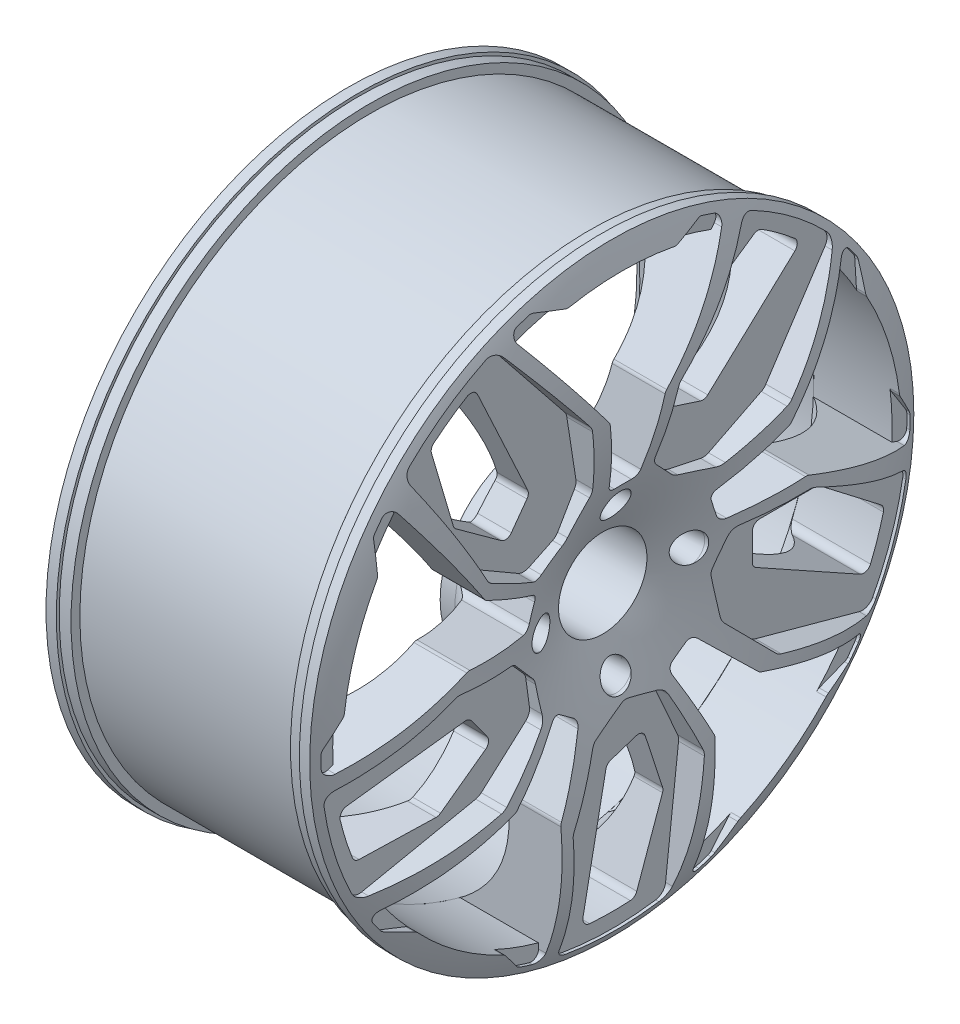
from build123d import *

# Parameters (mm, degrees)
WYTNIJ_WYCI_GNI_CIE1_DEPTH      = 352.055668779
WYTNIJ_WYCI_GNI_CIE1_DEPTH_BACK = 352.055668779
SZKIC2_R                        = 30.05
WYTNIJ_WYCI_GNI_CIE2_DEPTH      = 352.055668779
WYTNIJ_WYCI_GNI_CIE3_DEPTH      = 18
SZYK_KO_OWY1_COUNT              = 4
SZYK_KO_OWY2_COUNT              = 5


with BuildPart() as part:
    # Szkic1 → Obrót1 (revolve)
    with BuildSketch(Plane.XY):
        with BuildLine():
            add(Edge.make_bspline(
                [(-40, 0), (26.596669876, 117.434125897), (-18.45, 205.2)],
                knots=[0, 0, 0, 1, 1, 1], degree=2))
            Line((-18.45, 205.2), (-25.45, 205.2))
            Line((-25.45, 205.2), (-25.45, 203.2))
            Line((-25.45, 203.2), (-33.45, 203.2))
            Line((-33.45, 203.2), (-33.45, 197.2))
            Line((-33.45, 197.2), (-182.55, 197.2))
            Line((-182.55, 197.2), (-182.55, 203.2))
            Line((-182.55, 203.2), (-190.55, 203.2))
            Line((-190.55, 203.2), (-190.55, 205.2))
            Line((-190.55, 205.2), (-197.55, 205.2))
            Line((-197.55, 205.2), (-197.55, 196.2))
            Line((-197.55, 196.2), (-189.55, 196.2))
            Line((-189.55, 196.2), (-189.55, 190.2))
            Line((-189.55, 190.2), (-71.45, 190.2))
            add(Edge.make_bspline(
                [(-51.339745962, 70), (-12.729816794, 148.683198845), (-71.45, 190.2)],
                knots=[0, 0, 0, 1, 1, 1], degree=2))
            ThreePointArc((-51.339745962, 70), (-55, 66.339745962), (-60, 65))
            Line((-60, 65), (-70, 65))
            Line((-70, 65), (-70, 0))
            Line((-70, 0), (-40, 0))
        make_face()
    revolve(axis=Axis((75.013055214, 0, 0), (-1, 0, 0)))

    # Szkic2 → Wytnij-wyciągnięcie1 (cut, two sides: drawn at the far end of the back side and taken through both)
    with BuildSketch(Plane(origin=(0, 0, 0), x_dir=(0, 0, -1), z_dir=(1, 0, 0)).offset(-WYTNIJ_WYCI_GNI_CIE1_DEPTH_BACK)):
        Circle(SZKIC2_R)
    extrude(amount=WYTNIJ_WYCI_GNI_CIE1_DEPTH + WYTNIJ_WYCI_GNI_CIE1_DEPTH_BACK, mode=Mode.SUBTRACT)

    # Szkic3 → Wytnij-wyciągnięcie2 (cut, through all)
    with BuildSketch(Plane.ZY):
        with BuildLine():
            Line((-5.804501844, 65), (5.804501844, 65))
            ThreePointArc((5.804501844, 65), (9.018439893, 66.169777784), (10.728540609, 69.131759112))
            Line((10.728540609, 69.131759112), (18.603891842, 113.79509538))
            ThreePointArc((18.603891842, 113.79509538), (18.951373211, 114.940587941), (19.561163905, 115.970661636))
            Line((19.561163905, 115.970661636), (67.000398245, 177.794675497))
            ThreePointArc((67.000398245, 177.794675497), (0, 190), (-67.000398245, 177.794675497))
            Line((-67.000398245, 177.794675497), (-19.561163905, 115.970661636))
            ThreePointArc((-19.561163905, 115.970661636), (-18.951373211, 114.940587941), (-18.603891842, 113.79509538))
            Line((-18.603891842, 113.79509538), (-10.728540609, 69.131759112))
            ThreePointArc((-10.728540609, 69.131759112), (-9.018439893, 66.169777784), (-5.804501844, 65))
        make_face()
        with BuildLine():
            Line((-53.036872232, 130.892264562), (-96.116536754, 160.440141412))
            ThreePointArc((-96.116536754, 160.440141412), (-98.85247676, 161.315983561), (-101.618849332, 160.541612862))
            ThreePointArc((-101.618849332, 160.541612862), (-113.022860164, 152.727970851), (-123.82855595, 144.105824766))
            ThreePointArc((-123.82855595, 144.105824766), (-125.568948745, 140.411591881), (-123.974717837, 136.651970689))
            Line((-123.974717837, 136.651970689), (-64.751951977, 81.58249317))
            ThreePointArc((-64.751951977, 81.58249317), (-62.428011411, 80.362313881), (-59.806203761, 80.487461371))
            Line((-59.806203761, 80.487461371), (-42.670200989, 86.038780052))
            ThreePointArc((-42.670200989, 86.038780052), (-39.75808846, 88.521573149), (-39.454513779, 92.336347501))
            Line((-39.454513779, 92.336347501), (-51.108377236, 128.309896845))
            ThreePointArc((-51.108377236, 128.309896845), (-51.858846738, 129.760728686), (-53.036872232, 130.892264562))
        make_face()
    wytnij_wyci_gni_cie2 = extrude(amount=WYTNIJ_WYCI_GNI_CIE2_DEPTH, mode=Mode.SUBTRACT)

    # Szkic4<8> → Wytnij-wyciągnięcie3 (cut)
    # profile 1 of 3: a face of its own
    with BuildSketch(Plane.ZY):
        with BuildLine():
            ThreePointArc((35.846549504, 186.587847645), (51.61108054, 182.855944299), (67.000398245, 177.794675497))
            Line((67.000398245, 177.794675497), (69.236227502, 180.708464914))
            ThreePointArc((69.236227502, 180.708464914), (70.064243225, 185.170038439), (66.943036719, 188.463868778))
            ThreePointArc((66.943036719, 188.463868778), (62.819117194, 189.878272888), (58.665347201, 191.202450397))
            ThreePointArc((58.665347201, 191.202450397), (57.313521972, 191.421070865), (55.95308507, 191.264744944))
            Line((55.95308507, 191.264744944), (38.035508206, 186.655698354))
            ThreePointArc((38.035508206, 186.655698354), (36.944789342, 186.500454436), (35.846549504, 186.587847645))
        make_face()
    # profile 2 of 3: a face of its own
    with BuildSketch(Plane.ZY):
        with BuildLine():
            Line((-69.236227502, 180.708464914), (-67.000398245, 177.794675497))
            ThreePointArc((-67.000398245, 177.794675497), (-51.61108054, 182.855944299), (-35.846549504, 186.587847645))
            ThreePointArc((-35.846549504, 186.587847645), (-36.944789342, 186.500454436), (-38.035508206, 186.655698354))
            Line((-38.035508206, 186.655698354), (-55.95308507, 191.264744944))
            ThreePointArc((-55.95308507, 191.264744944), (-57.313521972, 191.421070865), (-58.665347201, 191.202450397))
            ThreePointArc((-58.665347201, 191.202450397), (-62.819117194, 189.878272888), (-66.943036719, 188.463868778))
            ThreePointArc((-66.943036719, 188.463868778), (-70.064243225, 185.170038439), (-69.236227502, 180.708464914))
        make_face()
    # profile 3 of 3: a face of its own
    with BuildSketch(Plane.ZY):
        with BuildLine():
            Line((-29.603339809, 117.200150288), (-82.943423381, 175.599802917))
            ThreePointArc((-82.943423381, 175.599802917), (-87.459320213, 178.08275221), (-92.552465992, 177.296477796))
            ThreePointArc((-92.552465992, 177.296477796), (-119.541473207, 160.342870697), (-143.494631157, 139.317230913))
            ThreePointArc((-143.494631157, 139.317230913), (-145.718999793, 134.501015693), (-144.441163507, 129.35214404))
            Line((-144.441163507, 129.35214404), (-104.249921372, 68.171114508))
            ThreePointArc((-104.249921372, 68.171114508), (-102.888958619, 66.593537623), (-101.166789658, 65.420889973))
            Line((-101.166789658, 65.420889973), (-65.23370998, 47.293994513))
            ThreePointArc((-65.23370998, 47.293994513), (-62.651854043, 46.502079197), (-59.953612613, 46.614342855))
            Line((-59.953612613, 46.614342855), (-37.777602294, 51.36835776))
            ThreePointArc((-37.777602294, 51.36835776), (-35.552157544, 52.206963799), (-33.671575259, 53.662736685))
            Line((-33.671575259, 53.662736685), (-21.236786118, 66.671236729))
            ThreePointArc((-21.236786118, 66.671236729), (-19.322143229, 70.020315338), (-19.197450808, 73.876043118))
            Line((-19.197450808, 73.876043118), (-27.688009951, 113.481877539))
            ThreePointArc((-27.688009951, 113.481877539), (-28.398375217, 115.468401133), (-29.603339809, 117.200150288))
        make_face()
        with BuildLine():
            ThreePointArc((-101.618849332, 160.541612862), (-98.85247676, 161.315983561), (-96.116536754, 160.440141412))
            Line((-96.116536754, 160.440141412), (-53.036872232, 130.892264562))
            ThreePointArc((-53.036872232, 130.892264562), (-51.858846738, 129.760728686), (-51.108377236, 128.309896845))
            Line((-51.108377236, 128.309896845), (-39.454513779, 92.336347501))
            ThreePointArc((-39.454513779, 92.336347501), (-39.75808846, 88.521573149), (-42.670200989, 86.038780052))
            Line((-42.670200989, 86.038780052), (-59.806203761, 80.487461371))
            ThreePointArc((-59.806203761, 80.487461371), (-62.428011411, 80.362313881), (-64.751951977, 81.58249317))
            Line((-64.751951977, 81.58249317), (-123.974717837, 136.651970689))
            ThreePointArc((-123.974717837, 136.651970689), (-125.568948745, 140.411591881), (-123.82855595, 144.105824766))
            ThreePointArc((-123.82855595, 144.105824766), (-113.022860164, 152.727970851), (-101.618849332, 160.541612862))
        make_face(mode=Mode.SUBTRACT)
    wytnij_wyci_gni_cie3 = extrude(amount=WYTNIJ_WYCI_GNI_CIE3_DEPTH, mode=Mode.SUBTRACT)

    # Szkic4 → Wycięcie-obrót1 (revolve, cut)
    with BuildSketch(Plane.XY):
        Polygon((-70, 50), (-0.274240735, 50), (-0.274240735, 60), (-15.274240735, 60), (-50, 56), (-70, 56), align=None)
    wyci_cie_obr_t1 = revolve(axis=Axis((-86.036022951, 50, 0), (1, 0, 0)), mode=Mode.SUBTRACT)

    # Szyk kołowy1: Wycięcie-obrót1 ×4 about axis
    szyk_ko_owy1_axis = Axis((-24.563145892, 0, 0), (1, 0, 0))
    for i in range(1, SZYK_KO_OWY1_COUNT):
        add(wyci_cie_obr_t1.rotate(szyk_ko_owy1_axis, i * 360 / SZYK_KO_OWY1_COUNT), mode=Mode.SUBTRACT)

    # Szyk kołowy2: Wytnij-wyciągnięcie2, Wytnij-wyciągnięcie3 ×5 about axis
    szyk_ko_owy2_axis = Axis((-24.563145892, 0, 0), (1, 0, 0))
    add([wytnij_wyci_gni_cie2.rotate(szyk_ko_owy2_axis, i * 360 / SZYK_KO_OWY2_COUNT) for i in range(1, SZYK_KO_OWY2_COUNT)], mode=Mode.SUBTRACT)
    add([wytnij_wyci_gni_cie3.rotate(szyk_ko_owy2_axis, i * 360 / SZYK_KO_OWY2_COUNT) for i in range(1, SZYK_KO_OWY2_COUNT)], mode=Mode.SUBTRACT)


solid = part.part
